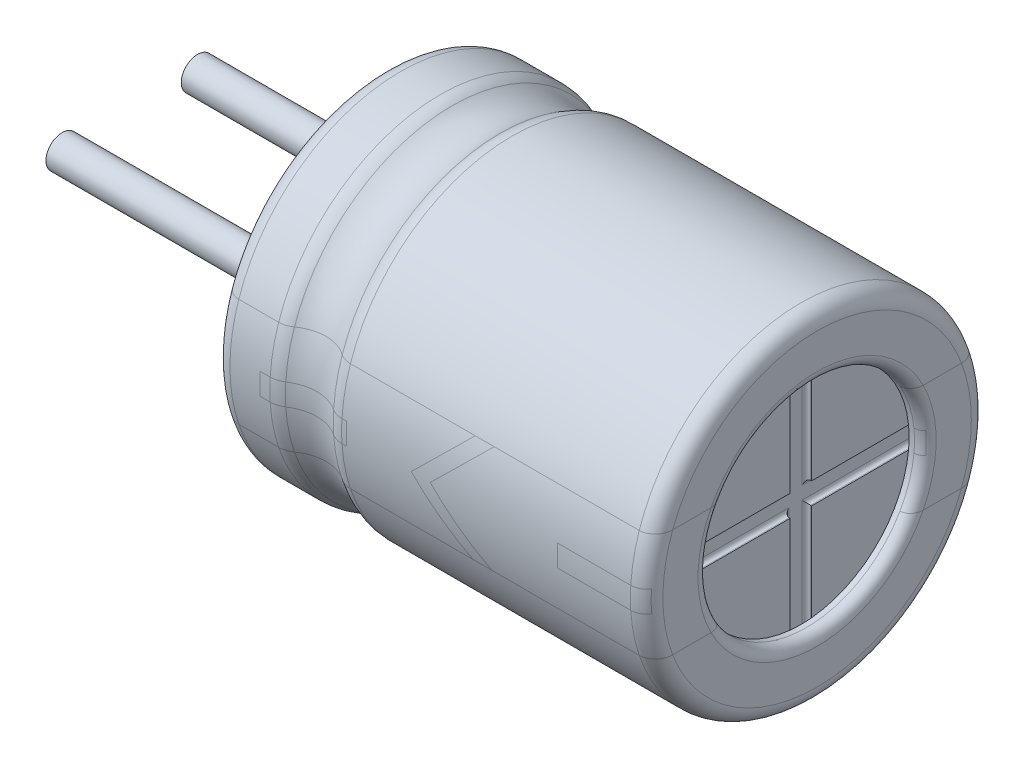
from build123d import *

# Parameters (mm, degrees)
FILLET_1_R          = 0.4
SKETCH_2_R          = 2
CUT_EXTRUDE_1_DEPTH = 0.3
FILLET_2_R          = 0.2
FILLET_3_R          = 0.3
CUT_EXTRUDE_2_DEPTH = 0.1
CUT_EXTRUDE_START   = -0.3
SKETCH_5_R          = 2
CUT_EXTRUDE_3_DEPTH = 0.3
FILLET_6_R          = 0.3
SKETCH_6_R          = 0.3
EXTRUDE_1_DEPTH     = 5
FILLET_7_R          = 0.08


with BuildPart() as part:
    # Эскиз1 → Повернуть1 (revolve)
    with BuildSketch(Plane(origin=(0, 0, 0), x_dir=(1, 0, 0), z_dir=(0, 1, 0)), mode=Mode.PRIVATE) as revolve_1_sk:
        with BuildLine():
            Line((0, 0), (0, 3.15))
            Line((0, 3.15), (1.170849738, 3.15))
            ThreePointArc((1.170849738, 3.15), (1.7, 2.95), (2.229150262, 3.15))
            Line((2.229150262, 3.15), (8, 3.15))
            Line((8, 3.15), (8, 0))
            Line((8, 0), (0, 0))
        make_face()
    revolve(revolve_1_sk.sketch.rotate(Axis((-17.233728413, 0, 0), (1, 0, 0)), 180), axis=Axis((-17.233728413, 0, 0), (1, 0, 0)))

    # Скругление1
    fillet_1_edges = [part.edges().sort_by_distance(p)[0] for p in [
        (1.170849738, 0, -3.15),
        (2.229150262, 0, -3.15),
    ]]
    fillet(fillet_1_edges, radius=FILLET_1_R)

    # Эскиз2 → Вырез-Вытянуть1 (cut)
    with BuildSketch(Plane(origin=(8, 0, 0), x_dir=(0, 0, -1), z_dir=(1, 0, 0))):
        Circle(SKETCH_2_R)
    extrude(amount=-CUT_EXTRUDE_1_DEPTH, mode=Mode.SUBTRACT)

    # Скругление2
    fillet_2_edges = [part.edges().sort_by_distance(p)[0] for p in [
        (8, 0, 2),
    ]]
    fillet(fillet_2_edges, radius=FILLET_2_R)

    # Скругление3
    fillet_3_edges = [part.edges().sort_by_distance(p)[0] for p in [
        (8, 0, -3.15),
    ]]
    fillet(fillet_3_edges, radius=FILLET_3_R)

    # Эскиз3 → Вырез-Вытянуть2 (cut)
    with BuildSketch(Plane(origin=(7.7, 0, 0), x_dir=(0, 0, -1), z_dir=(1, 0, 0))):
        with BuildLine():
            Line((-0.2, 2.364762642), (-0.2, 0.2))
            Line((-0.2, 0.2), (-2.364762642, 0.2))
            ThreePointArc((-2.364762642, 0.2), (-2.373205081, 0), (-2.364762642, -0.2))
            Line((-2.364762642, -0.2), (-0.2, -0.2))
            Line((-0.2, -0.2), (-0.2, -2.364762642))
            ThreePointArc((-0.2, -2.364762642), (0, -2.373205081), (0.2, -2.364762642))
            Line((0.2, -2.364762642), (0.2, -0.2))
            Line((0.2, -0.2), (2.364762642, -0.2))
            ThreePointArc((2.364762642, -0.2), (2.373205081, 0), (2.364762642, 0.2))
            Line((2.364762642, 0.2), (0.2, 0.2))
            Line((0.2, 0.2), (0.2, 2.364762642))
            ThreePointArc((0.2, 2.364762642), (0, 2.373205081), (-0.2, 2.364762642))
        make_face()
    extrude(amount=-CUT_EXTRUDE_2_DEPTH, mode=Mode.SUBTRACT)

    # Эскиз5 → Вырез-Вытянуть3 (cut)
    with BuildSketch(Plane.ZY.offset(CUT_EXTRUDE_START)):
        with Locations(Location((0, 0, 0), (0, 0, 185.739170477))):
            Circle(SKETCH_5_R)
    extrude(amount=CUT_EXTRUDE_3_DEPTH, mode=Mode.SUBTRACT)

    # Скругление6
    fillet_6_edges = [part.edges().sort_by_distance(p)[0] for p in [
        (0, 0, -3.15),
        (0, 0.2, 1.989974874),
    ]]
    fillet(fillet_6_edges, radius=FILLET_6_R - 0.0001)  # a hair under: the kernel refuses the full size

    # Эскиз6 → Бобышка-Вытянуть1 (add)
    with BuildSketch(Plane.ZY.offset(-0.3)):
        with Locations((-1.25, 0)):
            Circle(SKETCH_6_R)
        with Locations(Location((1.25, 0, 0), (0, 0, 180))):
            Circle(SKETCH_6_R)
    extrude(amount=EXTRUDE_1_DEPTH)

    # Скругление7
    fillet_7_edges = [part.edges().sort_by_distance(p)[0] for p in [
        (7.6, 1.282381321, -0.2),
        (7.6, 0.2, -1.282381321),
        (7.6, -0.2, -1.282381321),
        (7.6, -1.282381321, -0.2),
        (7.6, -1.282381321, 0.2),
        (7.6, -0.2, 1.282381321),
        (7.6, 0.2, 1.282381321),
        (7.6, 1.282381321, 0.2),
    ]]
    fillet(fillet_7_edges, radius=FILLET_7_R)


solid = part.part
